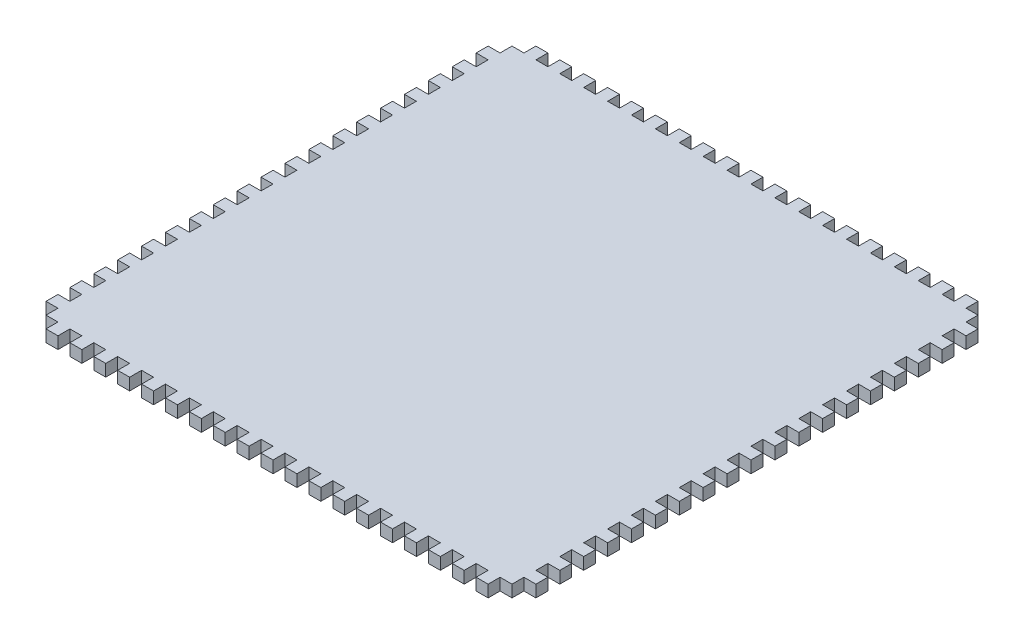
from build123d import *

# Parameters (mm, degrees)
SKETCH1_W                = 260.35
SKETCH1_H                = 260.35
BOSS_EXTRUDE1_DEPTH      = 6.35
SKETCH2_W                = 6.35
SKETCH2_H                = 6.35
CUT_EXTRUDE1_DEPTH       = 185.204733245
LPATTERN1_COUNT          = 20
LPATTERN1_PITCH          = 12.7
MIRROR1_COPY_1_SKETCH_W  = 6.35
MIRROR1_COPY_1_SKETCH_H  = 6.35
MIRROR1_COPY_1_DEPTH     = 185.204733245
MIRROR1_COPY_2_SKETCH_W  = 6.35
MIRROR1_COPY_2_SKETCH_H  = 6.35
MIRROR1_COPY_2_DEPTH     = 185.204733245
MIRROR1_COPY_3_SKETCH_W  = 6.35
MIRROR1_COPY_3_SKETCH_H  = 6.35
MIRROR1_COPY_3_DEPTH     = 185.204733245
MIRROR1_COPY_4_SKETCH_W  = 6.35
MIRROR1_COPY_4_SKETCH_H  = 6.35
MIRROR1_COPY_4_DEPTH     = 185.204733245
MIRROR1_COPY_5_SKETCH_W  = 6.35
MIRROR1_COPY_5_SKETCH_H  = 6.35
MIRROR1_COPY_5_DEPTH     = 185.204733245
MIRROR1_COPY_6_SKETCH_W  = 6.35
MIRROR1_COPY_6_SKETCH_H  = 6.35
MIRROR1_COPY_6_DEPTH     = 185.204733245
MIRROR1_COPY_7_SKETCH_W  = 6.35
MIRROR1_COPY_7_SKETCH_H  = 6.35
MIRROR1_COPY_7_DEPTH     = 185.204733245
MIRROR1_COPY_8_SKETCH_W  = 6.35
MIRROR1_COPY_8_SKETCH_H  = 6.35
MIRROR1_COPY_8_DEPTH     = 185.204733245
MIRROR1_COPY_9_SKETCH_W  = 6.35
MIRROR1_COPY_9_SKETCH_H  = 6.35
MIRROR1_COPY_9_DEPTH     = 185.204733245
MIRROR1_COPY_10_SKETCH_W = 6.35
MIRROR1_COPY_10_SKETCH_H = 6.35
MIRROR1_COPY_10_DEPTH    = 185.204733245
MIRROR1_COPY_11_SKETCH_W = 6.35
MIRROR1_COPY_11_SKETCH_H = 6.35
MIRROR1_COPY_11_DEPTH    = 185.204733245
MIRROR1_COPY_12_SKETCH_W = 6.35
MIRROR1_COPY_12_SKETCH_H = 6.35
MIRROR1_COPY_12_DEPTH    = 185.204733245
MIRROR1_COPY_13_SKETCH_W = 6.35
MIRROR1_COPY_13_SKETCH_H = 6.35
MIRROR1_COPY_13_DEPTH    = 185.204733245
MIRROR1_COPY_14_SKETCH_W = 6.35
MIRROR1_COPY_14_SKETCH_H = 6.35
MIRROR1_COPY_14_DEPTH    = 185.204733245
MIRROR1_COPY_15_SKETCH_W = 6.35
MIRROR1_COPY_15_SKETCH_H = 6.35
MIRROR1_COPY_15_DEPTH    = 185.204733245
MIRROR1_COPY_16_SKETCH_W = 6.35
MIRROR1_COPY_16_SKETCH_H = 6.35
MIRROR1_COPY_16_DEPTH    = 185.204733245
MIRROR1_COPY_17_SKETCH_W = 6.35
MIRROR1_COPY_17_SKETCH_H = 6.35
MIRROR1_COPY_17_DEPTH    = 185.204733245
MIRROR1_COPY_18_SKETCH_W = 6.35
MIRROR1_COPY_18_SKETCH_H = 6.35
MIRROR1_COPY_18_DEPTH    = 185.204733245
MIRROR1_COPY_19_SKETCH_W = 6.35
MIRROR1_COPY_19_SKETCH_H = 6.35
MIRROR1_COPY_19_DEPTH    = 185.204733245
SKETCH3_W                = 6.35
SKETCH3_H                = 6.35
CUT_EXTRUDE5_DEPTH       = 6.35
LPATTERN2_START          = -130.175
LPATTERN2_OUTLINE_W      = 6.35
LPATTERN2_OUTLINE_H      = 6.35
LPATTERN2_OUTLINE_H_2    = 12.7
LPATTERN2_DEPTH          = 6.35


# Read off the part's stored shape, not the designer's step: LPattern2, Mirror2
with BuildPart() as part:
    # Sketch1 → Boss-Extrude1 (new body)
    with BuildSketch(Plane(origin=(0, 0, 0), x_dir=(1, 0, 0), z_dir=(0, 1, 0))):
        Rectangle(SKETCH1_W, SKETCH1_H)
    extrude(amount=BOSS_EXTRUDE1_DEPTH)

    # Sketch2 → Cut-Extrude1 (cut, through all)
    with BuildSketch(Plane(origin=(0, 6.35, 0), x_dir=(1, 0, 0), z_dir=(0, 1, 0))):
        with Locations((-120.65, 127)):
            Rectangle(SKETCH2_W, SKETCH2_H)
    cut_extrude1 = extrude(amount=-CUT_EXTRUDE1_DEPTH, mode=Mode.SUBTRACT)

    # LPattern1: Cut-Extrude1 ×20
    with Locations(*[(i * LPATTERN1_PITCH, 0, 0) for i in range(1, LPATTERN1_COUNT)]):
        add(cut_extrude1, mode=Mode.SUBTRACT)

    # Mirror1: Cut-Extrude1 across plane
    add(cut_extrude1.mirror(Plane.XY), mode=Mode.SUBTRACT)

    # Mirror1 copy 1 sketch → Mirror1 copy 1 (cut, through all)
    with BuildSketch(Plane(origin=(12.7, 6.35, 0), x_dir=(1, 0, 0), z_dir=(0, 1, 0))):
        with Locations((-120.65, -127)):
            Rectangle(MIRROR1_COPY_1_SKETCH_W, MIRROR1_COPY_1_SKETCH_H)
    extrude(amount=-MIRROR1_COPY_1_DEPTH, mode=Mode.SUBTRACT)

    # Mirror1 copy 2 sketch → Mirror1 copy 2 (cut, through all)
    with BuildSketch(Plane(origin=(25.4, 6.35, 0), x_dir=(1, 0, 0), z_dir=(0, 1, 0))):
        with Locations((-120.65, -127)):
            Rectangle(MIRROR1_COPY_2_SKETCH_W, MIRROR1_COPY_2_SKETCH_H)
    extrude(amount=-MIRROR1_COPY_2_DEPTH, mode=Mode.SUBTRACT)

    # Mirror1 copy 3 sketch → Mirror1 copy 3 (cut, through all)
    with BuildSketch(Plane(origin=(38.1, 6.35, 0), x_dir=(1, 0, 0), z_dir=(0, 1, 0))):
        with Locations((-120.65, -127)):
            Rectangle(MIRROR1_COPY_3_SKETCH_W, MIRROR1_COPY_3_SKETCH_H)
    extrude(amount=-MIRROR1_COPY_3_DEPTH, mode=Mode.SUBTRACT)

    # Mirror1 copy 4 sketch → Mirror1 copy 4 (cut, through all)
    with BuildSketch(Plane(origin=(50.8, 6.35, 0), x_dir=(1, 0, 0), z_dir=(0, 1, 0))):
        with Locations((-120.65, -127)):
            Rectangle(MIRROR1_COPY_4_SKETCH_W, MIRROR1_COPY_4_SKETCH_H)
    extrude(amount=-MIRROR1_COPY_4_DEPTH, mode=Mode.SUBTRACT)

    # Mirror1 copy 5 sketch → Mirror1 copy 5 (cut, through all)
    with BuildSketch(Plane(origin=(63.5, 6.35, 0), x_dir=(1, 0, 0), z_dir=(0, 1, 0))):
        with Locations((-120.65, -127)):
            Rectangle(MIRROR1_COPY_5_SKETCH_W, MIRROR1_COPY_5_SKETCH_H)
    extrude(amount=-MIRROR1_COPY_5_DEPTH, mode=Mode.SUBTRACT)

    # Mirror1 copy 6 sketch → Mirror1 copy 6 (cut, through all)
    with BuildSketch(Plane(origin=(76.2, 6.35, 0), x_dir=(1, 0, 0), z_dir=(0, 1, 0))):
        with Locations((-120.65, -127)):
            Rectangle(MIRROR1_COPY_6_SKETCH_W, MIRROR1_COPY_6_SKETCH_H)
    extrude(amount=-MIRROR1_COPY_6_DEPTH, mode=Mode.SUBTRACT)

    # Mirror1 copy 7 sketch → Mirror1 copy 7 (cut, through all)
    with BuildSketch(Plane(origin=(88.9, 6.35, 0), x_dir=(1, 0, 0), z_dir=(0, 1, 0))):
        with Locations((-120.65, -127)):
            Rectangle(MIRROR1_COPY_7_SKETCH_W, MIRROR1_COPY_7_SKETCH_H)
    extrude(amount=-MIRROR1_COPY_7_DEPTH, mode=Mode.SUBTRACT)

    # Mirror1 copy 8 sketch → Mirror1 copy 8 (cut, through all)
    with BuildSketch(Plane(origin=(101.6, 6.35, 0), x_dir=(1, 0, 0), z_dir=(0, 1, 0))):
        with Locations((-120.65, -127)):
            Rectangle(MIRROR1_COPY_8_SKETCH_W, MIRROR1_COPY_8_SKETCH_H)
    extrude(amount=-MIRROR1_COPY_8_DEPTH, mode=Mode.SUBTRACT)

    # Mirror1 copy 9 sketch → Mirror1 copy 9 (cut, through all)
    with BuildSketch(Plane(origin=(114.3, 6.35, 0), x_dir=(1, 0, 0), z_dir=(0, 1, 0))):
        with Locations((-120.65, -127)):
            Rectangle(MIRROR1_COPY_9_SKETCH_W, MIRROR1_COPY_9_SKETCH_H)
    extrude(amount=-MIRROR1_COPY_9_DEPTH, mode=Mode.SUBTRACT)

    # Mirror1 copy 10 sketch → Mirror1 copy 10 (cut, through all)
    with BuildSketch(Plane(origin=(127, 6.35, 0), x_dir=(1, 0, 0), z_dir=(0, 1, 0))):
        with Locations((-120.65, -127)):
            Rectangle(MIRROR1_COPY_10_SKETCH_W, MIRROR1_COPY_10_SKETCH_H)
    extrude(amount=-MIRROR1_COPY_10_DEPTH, mode=Mode.SUBTRACT)

    # Mirror1 copy 11 sketch → Mirror1 copy 11 (cut, through all)
    with BuildSketch(Plane(origin=(139.7, 6.35, 0), x_dir=(1, 0, 0), z_dir=(0, 1, 0))):
        with Locations((-120.65, -127)):
            Rectangle(MIRROR1_COPY_11_SKETCH_W, MIRROR1_COPY_11_SKETCH_H)
    extrude(amount=-MIRROR1_COPY_11_DEPTH, mode=Mode.SUBTRACT)

    # Mirror1 copy 12 sketch → Mirror1 copy 12 (cut, through all)
    with BuildSketch(Plane(origin=(152.4, 6.35, 0), x_dir=(1, 0, 0), z_dir=(0, 1, 0))):
        with Locations((-120.65, -127)):
            Rectangle(MIRROR1_COPY_12_SKETCH_W, MIRROR1_COPY_12_SKETCH_H)
    extrude(amount=-MIRROR1_COPY_12_DEPTH, mode=Mode.SUBTRACT)

    # Mirror1 copy 13 sketch → Mirror1 copy 13 (cut, through all)
    with BuildSketch(Plane(origin=(165.1, 6.35, 0), x_dir=(1, 0, 0), z_dir=(0, 1, 0))):
        with Locations((-120.65, -127)):
            Rectangle(MIRROR1_COPY_13_SKETCH_W, MIRROR1_COPY_13_SKETCH_H)
    extrude(amount=-MIRROR1_COPY_13_DEPTH, mode=Mode.SUBTRACT)

    # Mirror1 copy 14 sketch → Mirror1 copy 14 (cut, through all)
    with BuildSketch(Plane(origin=(177.8, 6.35, 0), x_dir=(1, 0, 0), z_dir=(0, 1, 0))):
        with Locations((-120.65, -127)):
            Rectangle(MIRROR1_COPY_14_SKETCH_W, MIRROR1_COPY_14_SKETCH_H)
    extrude(amount=-MIRROR1_COPY_14_DEPTH, mode=Mode.SUBTRACT)

    # Mirror1 copy 15 sketch → Mirror1 copy 15 (cut, through all)
    with BuildSketch(Plane(origin=(190.5, 6.35, 0), x_dir=(1, 0, 0), z_dir=(0, 1, 0))):
        with Locations((-120.65, -127)):
            Rectangle(MIRROR1_COPY_15_SKETCH_W, MIRROR1_COPY_15_SKETCH_H)
    extrude(amount=-MIRROR1_COPY_15_DEPTH, mode=Mode.SUBTRACT)

    # Mirror1 copy 16 sketch → Mirror1 copy 16 (cut, through all)
    with BuildSketch(Plane(origin=(203.2, 6.35, 0), x_dir=(1, 0, 0), z_dir=(0, 1, 0))):
        with Locations((-120.65, -127)):
            Rectangle(MIRROR1_COPY_16_SKETCH_W, MIRROR1_COPY_16_SKETCH_H)
    extrude(amount=-MIRROR1_COPY_16_DEPTH, mode=Mode.SUBTRACT)

    # Mirror1 copy 17 sketch → Mirror1 copy 17 (cut, through all)
    with BuildSketch(Plane(origin=(215.9, 6.35, 0), x_dir=(1, 0, 0), z_dir=(0, 1, 0))):
        with Locations((-120.65, -127)):
            Rectangle(MIRROR1_COPY_17_SKETCH_W, MIRROR1_COPY_17_SKETCH_H)
    extrude(amount=-MIRROR1_COPY_17_DEPTH, mode=Mode.SUBTRACT)

    # Mirror1 copy 18 sketch → Mirror1 copy 18 (cut, through all)
    with BuildSketch(Plane(origin=(228.6, 6.35, 0), x_dir=(1, 0, 0), z_dir=(0, 1, 0))):
        with Locations((-120.65, -127)):
            Rectangle(MIRROR1_COPY_18_SKETCH_W, MIRROR1_COPY_18_SKETCH_H)
    extrude(amount=-MIRROR1_COPY_18_DEPTH, mode=Mode.SUBTRACT)

    # Mirror1 copy 19 sketch → Mirror1 copy 19 (cut, through all)
    with BuildSketch(Plane(origin=(241.3, 6.35, 0), x_dir=(1, 0, 0), z_dir=(0, 1, 0))):
        with Locations((-120.65, -127)):
            Rectangle(MIRROR1_COPY_19_SKETCH_W, MIRROR1_COPY_19_SKETCH_H)
    extrude(amount=-MIRROR1_COPY_19_DEPTH, mode=Mode.SUBTRACT)

    # Sketch3 → Cut-Extrude5 (cut)
    with BuildSketch(Plane(origin=(0, 6.35, 0), x_dir=(1, 0, 0), z_dir=(0, 1, 0))):
        with Locations((-127, 120.65)):
            Rectangle(SKETCH3_W, SKETCH3_H)
    extrude(amount=-CUT_EXTRUDE5_DEPTH, mode=Mode.SUBTRACT)


with BuildPart() as body_2:
    # of the pieces the cut leaves, the one that is kept (cut_extrude5_keep)
    add(part.part.solids().sort_by_distance((-130.175, 0, 130.175))[0])

    # LPattern2 outline → LPattern2 (cut)
    with BuildSketch(Plane.YZ.offset(LPATTERN2_START)):
        with Locations((3.175, -107.95)):
            Rectangle(LPATTERN2_OUTLINE_W, LPATTERN2_OUTLINE_H)
        with Locations((3.175, -95.25)):
            Rectangle(LPATTERN2_OUTLINE_W, LPATTERN2_OUTLINE_H)
        with Locations((3.175, -82.55)):
            Rectangle(LPATTERN2_OUTLINE_W, LPATTERN2_OUTLINE_H)
        with Locations((3.175, -69.85)):
            Rectangle(LPATTERN2_OUTLINE_W, LPATTERN2_OUTLINE_H)
        with Locations((3.175, -57.15)):
            Rectangle(LPATTERN2_OUTLINE_W, LPATTERN2_OUTLINE_H)
        with Locations((3.175, -44.45)):
            Rectangle(LPATTERN2_OUTLINE_W, LPATTERN2_OUTLINE_H)
        with Locations((3.175, -31.75)):
            Rectangle(LPATTERN2_OUTLINE_W, LPATTERN2_OUTLINE_H)
        with Locations((3.175, -19.05)):
            Rectangle(LPATTERN2_OUTLINE_W, LPATTERN2_OUTLINE_H)
        with Locations((3.175, -6.35)):
            Rectangle(LPATTERN2_OUTLINE_W, LPATTERN2_OUTLINE_H)
        with Locations((3.175, 6.35)):
            Rectangle(LPATTERN2_OUTLINE_W, LPATTERN2_OUTLINE_H)
        with Locations((3.175, 19.05)):
            Rectangle(LPATTERN2_OUTLINE_W, LPATTERN2_OUTLINE_H)
        with Locations((3.175, 31.75)):
            Rectangle(LPATTERN2_OUTLINE_W, LPATTERN2_OUTLINE_H)
        with Locations((3.175, 44.45)):
            Rectangle(LPATTERN2_OUTLINE_W, LPATTERN2_OUTLINE_H)
        with Locations((3.175, 57.15)):
            Rectangle(LPATTERN2_OUTLINE_W, LPATTERN2_OUTLINE_H)
        with Locations((3.175, 69.85)):
            Rectangle(LPATTERN2_OUTLINE_W, LPATTERN2_OUTLINE_H)
        with Locations((3.175, 82.55)):
            Rectangle(LPATTERN2_OUTLINE_W, LPATTERN2_OUTLINE_H)
        with Locations((3.175, 95.25)):
            Rectangle(LPATTERN2_OUTLINE_W, LPATTERN2_OUTLINE_H)
        with Locations((3.175, 107.95)):
            Rectangle(LPATTERN2_OUTLINE_W, LPATTERN2_OUTLINE_H)
        with Locations((3.175, 123.825)):
            Rectangle(LPATTERN2_OUTLINE_W, LPATTERN2_OUTLINE_H_2)
    extrude(amount=LPATTERN2_DEPTH, mode=Mode.SUBTRACT)

    # Mirror2
    split(bisect_by=Plane(origin=(0, 0, 0), x_dir=(0, 0, 1), z_dir=(1, 0, 0)), keep=Keep.BOTTOM)

    # Mirror2 2: body 2 across plane


with BuildPart() as body_2_1:
    add(body_2.part)
    add(body_2.part.mirror(Plane(origin=(0, 0, 0), x_dir=(0, 0, 1), z_dir=(1, 0, 0))))


solid = body_2_1.part
